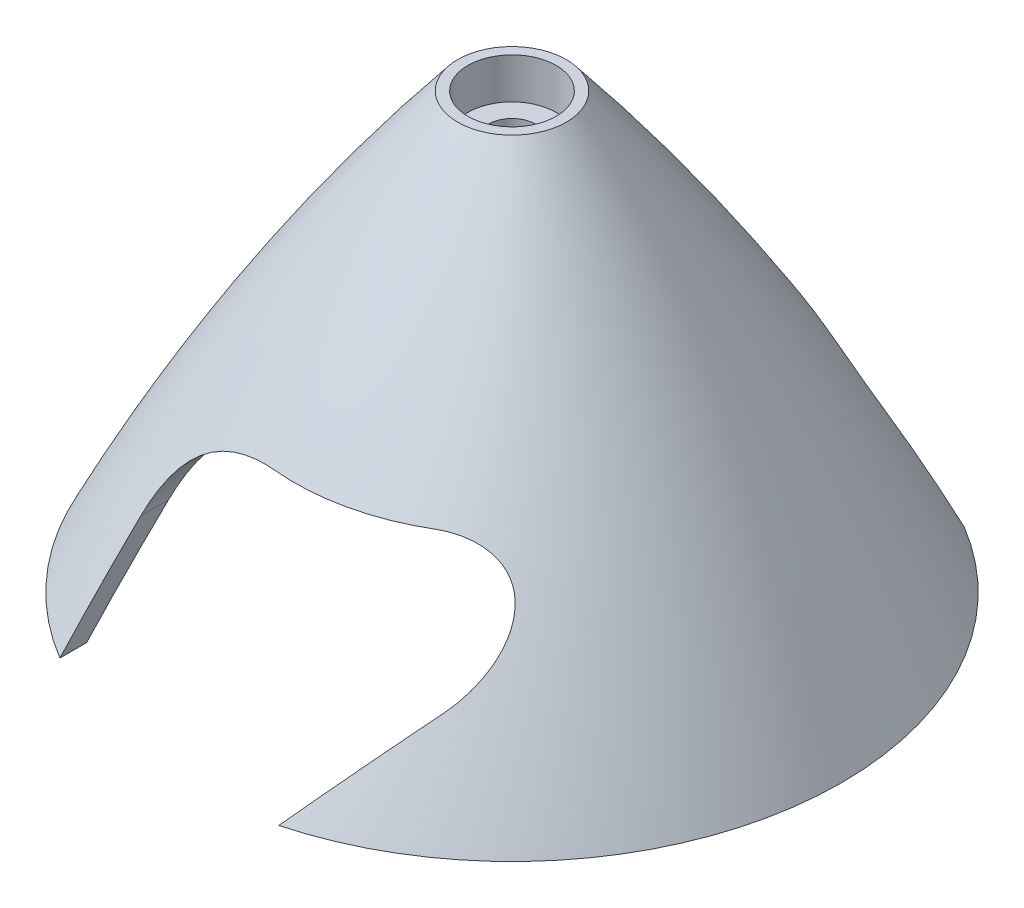
from build123d import *

# Parameters (mm, degrees)
SKETCH_7_R               = 3.25
CUT_EXTRUDE_1_DEPTH      = 3
SKETCH_8_R               = 1.75
CUT_EXTRUDE_2_DEPTH      = 40
CUT_EXTRUDE_3_DEPTH      = 30
PATTERN_CIRCULAR_1_COUNT = 2


# Read off the part's stored shape, not the designer's step: 쉘1
with BuildPart() as part:
    # 스케치1 → 회전1 (revolve)
    with BuildSketch(Plane.XY, mode=Mode.PRIVATE) as revolve_1_sk:
        with BuildLine():
            Line((0, 32), (0, 0))
            Line((0, 0), (-24.285796176, 0))
            ThreePointArc((-24.285796176, 0), (-15.037169396, 16.566906421), (-4, 32))
            Line((-4, 32), (0, 32))
        make_face()
    revolve(revolve_1_sk.sketch.rotate(Axis((0, 108.7652361, 0), (0, -1, 0)), 270), axis=Axis((0, 108.7652361, 0), (0, -1, 0)))

    # 쉘1 outline → 쉘1 (revolve, cut)
    with BuildSketch(Plane.XY):
        with BuildLine():
            ThreePointArc((22.615498991, 0), (14.939810561, 13.89190703), (5.991113868, 27))
            Line((5.991113868, 27), (0, 27))
            Line((0, 27), (0, 0))
            Line((0, 0), (22.615498991, 0))
        make_face()
    revolve(axis=Axis((0, 0, 0), (0, 1, 0)), mode=Mode.SUBTRACT)

    # 스케치7 → 돌출1 (cut)
    with BuildSketch(Plane(origin=(0, 32, 0), x_dir=(1, 0, 0), z_dir=(0, 1, 0))):
        with Locations(Location((0, 0, 0), (0, 0, 270))):
            Circle(SKETCH_7_R)
    extrude(amount=-CUT_EXTRUDE_1_DEPTH, mode=Mode.SUBTRACT)

    # 스케치8 → 돌출2 (cut)
    with BuildSketch(Plane(origin=(0, 0, 0), x_dir=(1, 0, 0), z_dir=(0, 1, 0))):
        with Locations(Location((0, 0, 0), (0, 0, 270))):
            Circle(SKETCH_8_R)
    extrude(amount=CUT_EXTRUDE_2_DEPTH, mode=Mode.SUBTRACT)

    # 스케치9 → 돌출3 (cut)
    with BuildSketch(Plane.XY):
        with BuildLine():
            Line((-13, -2), (4.6, -2))
            Line((4.6, -2), (11.972381343, 6.786061952))
            ThreePointArc((11.972381343, 6.786061952), (12.673698063, 12.113091309), (8.142159127, 15))
            Line((8.142159127, 15), (-1.538920837, 15))
            ThreePointArc((-1.538920837, 15), (-7.017773698, 13.140180063), (-10.232253273, 8.329371406))
            Line((-10.232253273, 8.329371406), (-13, -2))
        make_face()
    cut_extrude_3 = extrude(amount=CUT_EXTRUDE_3_DEPTH, mode=Mode.SUBTRACT)

    # 원형 패턴1: 돌출3 ×2 about axis
    pattern_circular_1_axis = Axis((0, 40, 0), (0, -1, 0))
    for i in range(1, PATTERN_CIRCULAR_1_COUNT):
        add(cut_extrude_3.rotate(pattern_circular_1_axis, i * 360 / PATTERN_CIRCULAR_1_COUNT), mode=Mode.SUBTRACT)


solid = part.part
